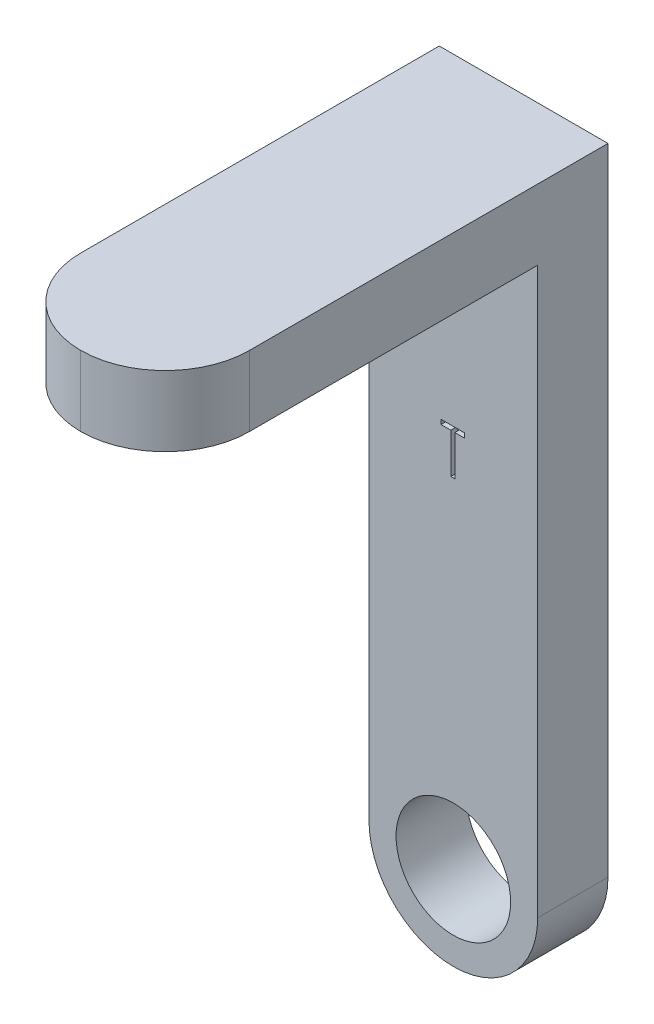
from build123d import *
from build123d.topology import SkipClean

# Parameters (mm, degrees)
SKETCH1_R           = 6
BOSS_EXTRUDE1_DEPTH = 5
BOSS_EXTRUDE2_START = -5
BOSS_EXTRUDE2_DEPTH = 5
CUT_EXTRUDE1_START  = -3
SKETCH3_R           = 4.075
CUT_EXTRUDE1_DEPTH  = 3
SKETCH4_W           = 12
SKETCH4_H           = 5
BOSS_EXTRUDE3_DEPTH = 26.5
FILLET1_R           = 6
CUT_EXTRUDE2_DEPTH  = 0.5


with BuildPart() as part:
    # Sketch1 → Boss-Extrude1 (new body)
    with BuildSketch(Plane.XY):
        Circle(SKETCH1_R)
        with BuildLine():
            Line((-2.837252192, 2.925), (2.837252192, 2.925))
            ThreePointArc((2.837252192, 2.925), (0, -4.075), (-2.837252192, 2.925))
        make_face(mode=Mode.SUBTRACT)
    extrude(amount=BOSS_EXTRUDE1_DEPTH)

    # Sketch2 → Boss-Extrude2 (add)
    with BuildSketch(Plane.XY.offset(5).offset(BOSS_EXTRUDE2_START)):
        with BuildLine():
            Line((-6, 0), (-6, 45.2))
            Line((-6, 45.2), (6, 45.2))
            Line((6, 45.2), (6, 0))
            ThreePointArc((6, 0), (0, 6), (-6, 0))
        make_face()
    extrude(amount=BOSS_EXTRUDE2_DEPTH)

    # Sketch3 → Cut-Extrude1 (cut)
    with SkipClean():  # the faces are left unmerged after this step: merging them gives an invalid solid
        with BuildSketch(Plane.XY.offset(5).offset(CUT_EXTRUDE1_START)):
            with Locations(Location((0, 0, 0), (0, 0, 134.127564998))):
                Circle(SKETCH3_R)
        extrude(amount=CUT_EXTRUDE1_DEPTH, mode=Mode.SUBTRACT)

    # Sketch4 → Boss-Extrude3 (add)
    with SkipClean():  # the faces are left unmerged after this step: merging them gives an invalid solid
        with BuildSketch(Plane.XY.offset(5)):
            with Locations((0, 42.7)):
                Rectangle(SKETCH4_W, SKETCH4_H)
        extrude(amount=BOSS_EXTRUDE3_DEPTH)

    # Fillet1
    fillet1_edges = [part.edges().sort_by_distance(p)[0] for p in [
        (-6, 42.7, 31.5),
        (6, 42.7, 31.5),
    ]]
    fillet(fillet1_edges, radius=FILLET1_R - 0.0001)  # a hair under: the kernel refuses the full size

    # Sketch6 → Cut-Extrude2 (cut)
    with BuildSketch(Plane.XY.offset(5)):
        Polygon((-0.872927967, 26.944055952), (-0.872927967, 27.269696978), (0.79598229, 27.269696978), (0.79598229, 26.944055952), (0.10399511, 26.944055952), (0.10399511, 24.094696978), (-0.180940787, 24.094696978), (-0.180940787, 26.944055952), align=None)
    extrude(amount=-CUT_EXTRUDE2_DEPTH, mode=Mode.SUBTRACT)


solid = part.part
